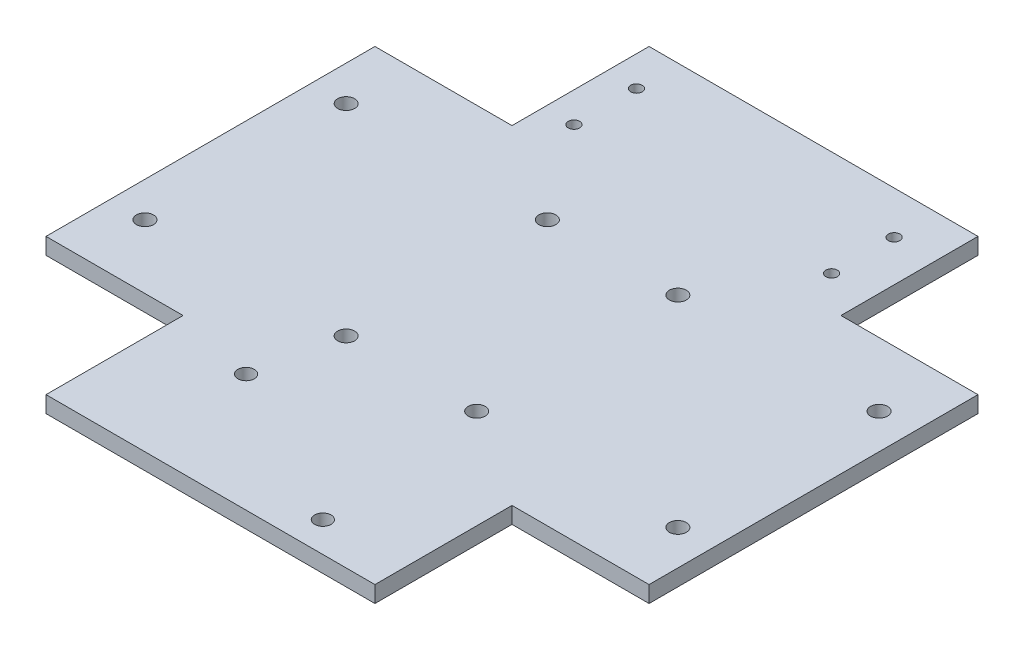
from build123d import *

# Parameters (mm, degrees)
SKETCH1_W           = 110
SKETCH1_H           = 110
SKETCH1_R           = 1.55
SKETCH1_R_2         = 1.05
SKETCH1_R_3         = 1.5
BOSS_EXTRUDE2_DEPTH = 3
SKETCH3_W           = 25
SKETCH3_H           = 25
CUT_EXTRUDE1_DEPTH  = 3


with BuildPart() as part:
    # Sketch1 → Boss-Extrude2 (new body)
    with BuildSketch(Plane(origin=(0, 0, 0), x_dir=(1, 0, 0), z_dir=(0, 1, 0))):
        Rectangle(SKETCH1_W, SKETCH1_H)
        with Locations((-48.6, 18.35)):
            Circle(SKETCH1_R, mode=Mode.SUBTRACT)
        with Locations((-11.9, 18.35)):
            Circle(SKETCH1_R, mode=Mode.SUBTRACT)
        with Locations((-11.9, -18.35)):
            Circle(SKETCH1_R, mode=Mode.SUBTRACT)
        with Locations((-48.6, -18.35)):
            Circle(SKETCH1_R, mode=Mode.SUBTRACT)
        with Locations((48.6, -18.35)):
            Circle(SKETCH1_R, mode=Mode.SUBTRACT)
        with Locations((11.9, -18.35)):
            Circle(SKETCH1_R, mode=Mode.SUBTRACT)
        with Locations((11.9, 18.35)):
            Circle(SKETCH1_R, mode=Mode.SUBTRACT)
        with Locations((48.6, 18.35)):
            Circle(SKETCH1_R, mode=Mode.SUBTRACT)
        with Locations((-24.5, 47.2)):
            Circle(SKETCH1_R_2, mode=Mode.SUBTRACT)
        with Locations((-24.5, 35.8)):
            Circle(SKETCH1_R_2, mode=Mode.SUBTRACT)
        with Locations((22.5, 47.2)):
            Circle(SKETCH1_R_2, mode=Mode.SUBTRACT)
        with Locations((22.5, 35.8)):
            Circle(SKETCH1_R_2, mode=Mode.SUBTRACT)
        with Locations((-15, -33.5)):
            Circle(SKETCH1_R_3, mode=Mode.SUBTRACT)
        with Locations((15, -49.5)):
            Circle(SKETCH1_R_3, mode=Mode.SUBTRACT)
    extrude(amount=BOSS_EXTRUDE2_DEPTH)

    # Sketch3 → Cut-Extrude1 (cut)
    with BuildSketch(Plane(origin=(0, 3, 0), x_dir=(1, 0, 0), z_dir=(0, 1, 0))):
        with Locations((42.5, 42.5)):
            Rectangle(SKETCH3_W, SKETCH3_H)
        with Locations((-42.5, 42.5)):
            Rectangle(SKETCH3_W, SKETCH3_H)
        with Locations((42.5, -42.5)):
            Rectangle(SKETCH3_W, SKETCH3_H)
        with Locations((-42.5, -42.5)):
            Rectangle(SKETCH3_W, SKETCH3_H)
    extrude(amount=-CUT_EXTRUDE1_DEPTH, mode=Mode.SUBTRACT)


solid = part.part
